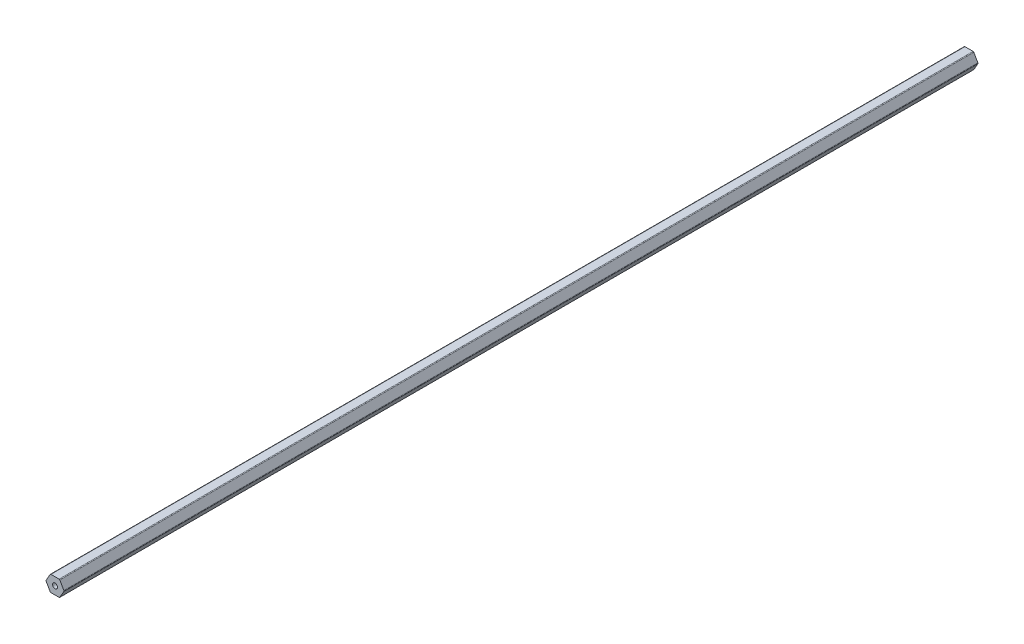
from build123d import *

# Parameters (mm, degrees)
SKETCH1_R           = 1.7145
BOSS_EXTRUDE1_DEPTH = 317.5
FILLET1_R           = 0.635


with BuildPart() as part:
    # Sketch1 → Boss-Extrude1 (new, symmetric)
    with BuildSketch(Plane.XY):
        Polygon((6.35, 0), (3.175, 5.499261314), (-3.175, 5.499261314), (-6.35, 0), (-3.175, -5.499261314), (3.175, -5.499261314), align=None)
        Circle(SKETCH1_R, mode=Mode.SUBTRACT)
    extrude(amount=BOSS_EXTRUDE1_DEPTH, both=True)

    # Fillet1
    fillet1_edges = [part.edges().sort_by_distance(p)[0] for p in [
        (3.175, -5.499261314, 0),
        (-3.175, -5.499261314, 0),
        (-6.35, 0, 0),
        (-3.175, 5.499261314, 0),
        (3.175, 5.499261314, 0),
        (6.35, 0, 0),
    ]]
    fillet(fillet1_edges, radius=FILLET1_R)


solid = part.part
